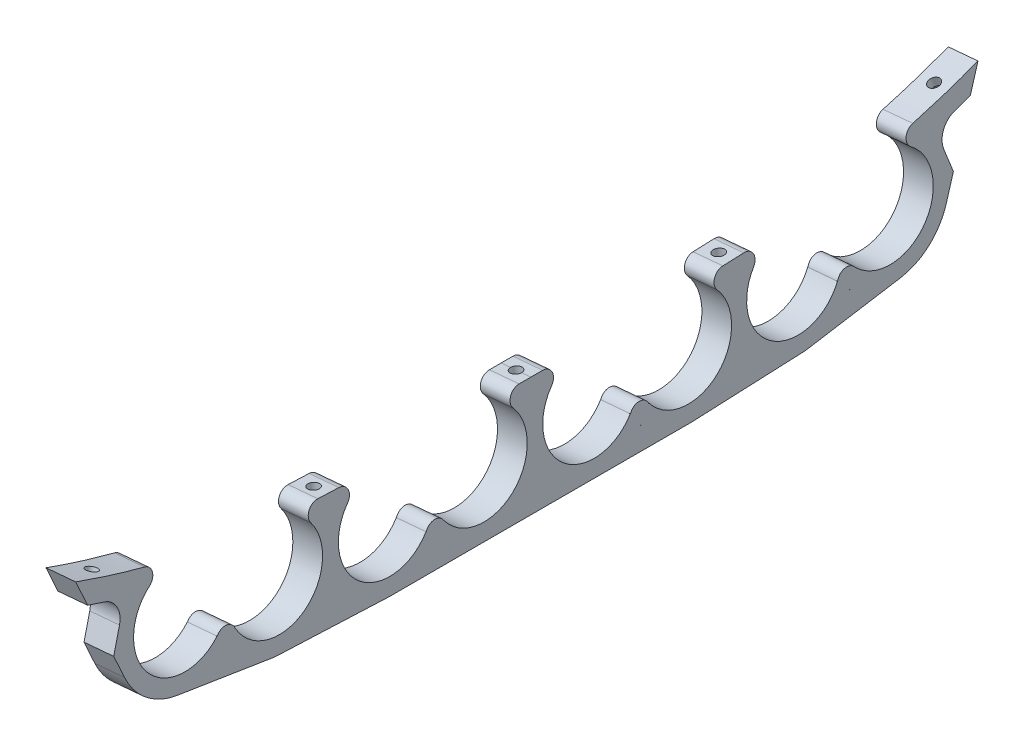
from build123d import *

# Parameters (mm, degrees)
BOSS_EXTRUDE1_START = -4.7625
BOSS_EXTRUDE1_DEPTH = 9.525
CUT_EXTRUDE1_START  = -3.556
CUT_EXTRUDE1_DEPTH  = 282.785297117
SKETCH4_R           = 1.778
CUT_EXTRUDE2_DEPTH  = 279.159394011
SKETCH5_R           = 2.921
CUT_EXTRUDE3_DEPTH  = 3.556
SKETCH6_R           = 1.778
CUT_EXTRUDE4_DEPTH  = 284.430700278
SKETCH7_R           = 2.921
CUT_EXTRUDE5_DEPTH  = 3.556
SKETCH8_R           = 1.778
CUT_EXTRUDE6_DEPTH  = 284.850761145


# Read off the part's stored shape, not the designer's step: Boss-Extrude1
with BuildPart() as part:
    # Boss-Extrude1 outline → Boss-Extrude1 (new body)
    with BuildSketch(Plane(origin=(-228.084917977, -19.938576691, -1.18e-07), x_dir=(5.118716060562233e-10, 4.474645392628448e-11, -1.0), z_dir=(0.9962008647199356, 0.08708522912212313, 5.138236917713649e-10)).offset(BOSS_EXTRUDE1_START)):
        with BuildLine():
            ThreePointArc((106.112573768, -24.014427618), (84.801506662, -29.633576123), (80.738401812, -7.971914366))
            ThreePointArc((80.738401812, -7.971914366), (80.982737482, -4.58538013), (78.026995026, -2.914481993))
            add(Edge.make_bspline(
                [(78.026995026, -2.914481993), (75.796061269, -3.025300864), (73.563882383, -3.110901905), (71.331157388, -3.172465654)],
                knots=[0.552662358, 0.552662358, 0.552662358, 0.552662358, 0.596719642, 0.596719642, 0.596719642, 0.596719642], degree=3))
            ThreePointArc((71.331157388, -3.172465654), (68.510117917, -5.073093143), (69.027544957, -8.435074375))
            ThreePointArc((69.027544957, -8.435074375), (67.134657912, -30.055875938), (45.606560008, -27.302136252))
            ThreePointArc((45.606560008, -27.302136252), (45.586817054, -27.341597019), (45.566987649, -27.381014415))
            ThreePointArc((45.566987649, -27.381014415), (42.639171658, -25.428949264), (39.708639952, -27.376935084))
            ThreePointArc((39.708639952, -27.376935084), (39.688865461, -27.33749011), (39.669177481, -27.298001886))
            ThreePointArc((39.669177481, -27.298001886), (18.196438142, -30.069314866), (16.175020916, -8.513049355))
            ThreePointArc((16.175020916, -8.513049355), (16.651150495, -5.120150934), (13.767438297, -3.270106872))
            add(Edge.make_bspline(
                [(13.767438297, -3.270106872), (12.51333277, -3.269468628), (11.25922718, -3.268778573), (10.005121591, -3.268088519)],
                knots=[0.975259294, 0.975259294, 0.975259294, 0.975259294, 1, 1, 1, 1], degree=3))
            Line((10.005121591, -3.268088519), (10.005121591, -38.444598674))
            Line((10.005121591, -38.444598674), (27.594621594, -38.444598674))
            Line((27.594621594, -38.444598674), (57.679597566, -38.465552566))
            ThreePointArc((57.679597566, -38.465552566), (58.093778372, -38.461579525), (58.507789747, -38.449085278))
            Line((58.507789747, -38.449085278), (93.658000789, -37.026204544))
            ThreePointArc((93.658000789, -37.026204544), (94.733052, -36.953825224), (95.80269018, -36.824025236))
            Line((95.80269018, -36.824025236), (125.574729046, -32.399731593))
            ThreePointArc((125.574729046, -32.399731593), (135.055544922, -28.314530372), (141.264479515, -20.066871922))
            Line((141.264479515, -20.066871922), (144.107545161, -13.070393168))
            Line((144.107545161, -13.070393168), (141.646976088, -5.930411575))
            ThreePointArc((141.646976088, -5.930411575), (142.003055106, -0.958206128), (145.839483669, 2.224785413))
            Line((145.839483669, 2.224785413), (150.966045758, 3.807639079))
            Line((150.966045758, 3.807639079), (154.106134877, 11.535060722))
            add(Edge.make_bspline(
                [(154.106134877, 11.535060722), (153.111959514, 11.196489288), (149.114455149, 9.853147022), (142.057237609, 7.670990331), (135.887203939, 6.015459011), (132.763739248, 5.234060117), (132.713280406, 5.221451519)],
                knots=[0.041773262, 0.041773262, 0.041773262, 0.041773262, 0.06250073, 0.125002606, 0.187506636, 0.188532883, 0.188532883, 0.188532883, 0.188532883], degree=3))
            ThreePointArc((132.713280406, 5.221451519), (130.369392848, 2.762612386), (131.589754054, -0.407626925))
            ThreePointArc((131.589754054, -0.407626925), (134.013026992, -22.317012563), (111.985468102, -23.141682248))
            ThreePointArc((111.985468102, -23.141682248), (111.971768934, -23.183626671), (111.957977855, -23.225540964))
            ThreePointArc((111.957977855, -23.225540964), (108.773982005, -21.727257864), (106.163261324, -24.086668669))
            ThreePointArc((106.163261324, -24.086668669), (106.137877957, -24.050575921), (106.112573768, -24.014427618))
        make_face()
        with BuildLine():
            ThreePointArc((42.710021485, -31.778107775), (42.634749976, -31.778947725), (42.55947971, -31.778002948))
            ThreePointArc((42.55947971, -31.778002948), (42.597203571, -31.735951998), (42.63480927, -31.693795344))
            ThreePointArc((42.63480927, -31.693795344), (42.672356223, -31.736004329), (42.710021485, -31.778107775))
        make_face(mode=Mode.SUBTRACT)
        with BuildLine():
            ThreePointArc((109.781702852, -27.996335289), (109.70737787, -28.008282634), (109.632790528, -28.018464504))
            ThreePointArc((109.632790528, -28.018464504), (109.66389187, -27.971301821), (109.694860726, -27.924052037))
            ThreePointArc((109.694860726, -27.924052037), (109.738231072, -27.960254595), (109.781702852, -27.996335289))
        make_face(mode=Mode.SUBTRACT)
    boss_extrude1 = extrude(amount=BOSS_EXTRUDE1_DEPTH)

    # Sketch3 → Cut-Extrude1 (cut)
    with BuildSketch(Plane(origin=(3.403167434, -38.930119016, -12.065723308), x_dir=(0.996532090421514, 0.0794795110303222, 0.02463331253624527), z_dir=(0.08320933096791158, -0.9518629984330792, -0.2950136258782986)).offset(CUT_EXTRUDE1_START)):
        with BuildLine():
            ThreePointArc((-229.611572015, -134.129981507), (-232.4089705, -131.73892561), (-235.325895799, -133.982613064))
            Line((-235.325895799, -133.982613064), (-229.611572015, -134.129981507))
        make_face()
        with BuildLine():
            Line((-229.611572015, -134.129981507), (-235.325895799, -133.982613064))
            ThreePointArc((-235.325895799, -133.982613064), (-232.824768048, -137.560041802), (-229.563276024, -134.658954733))
            ThreePointArc((-229.563276024, -134.658954733), (-229.57537508, -134.393368035), (-229.611572015, -134.129981507))
        make_face()
    cut_extrude1 = extrude(amount=CUT_EXTRUDE1_DEPTH, mode=Mode.SUBTRACT)

    # Sketch4 → Cut-Extrude2 (cut, through all)
    with BuildSketch(Plane(origin=(3.107275053, -35.545294193, -11.016654855), x_dir=(0.996532090421514, 0.07947951103032218, 0.02463331253624531), z_dir=(0.08320933096791154, -0.9518629984330789, -0.295013625878299))):
        with Locations(Location((-232.484276024, -134.658954733, 0), (0, 0, 270))):
            Circle(SKETCH4_R)
    cut_extrude2 = extrude(amount=-CUT_EXTRUDE2_DEPTH, mode=Mode.SUBTRACT)

    # Sketch5 → Cut-Extrude3 (cut)
    with BuildSketch(Plane(origin=(3.548784531, -40.595888117, -1.649588782), x_dir=(0.9962070917456914, 0.08694221859552977, 0.0035328432287039706), z_dir=(0.08701396643982783, -0.9953856637125653, -0.04044688022461796))):
        with Locations(Location((-229.154517137, -73.701115624, 0), (0, 0, 359.797416796))):
            Circle(SKETCH5_R)
    cut_extrude3 = extrude(amount=-CUT_EXTRUDE3_DEPTH, mode=Mode.SUBTRACT)

    # Sketch6 → Cut-Extrude4 (cut, through all)
    with BuildSketch(Plane(origin=(3.239362867, -37.056296697, -1.505759676), x_dir=(-0.9962070917456914, -0.0869422185955298, -0.0035328432287039723), z_dir=(0.08701396643982785, -0.9953856637125653, -0.04044688022461797))):
        with Locations(Location((229.154517137, 73.701115624, 0), (0, 0, 179.797416796))):
            Circle(SKETCH6_R)
    cut_extrude4 = extrude(amount=-CUT_EXTRUDE4_DEPTH, mode=Mode.SUBTRACT)

    # Mirror1: Boss-Extrude1, Cut-Extrude1, Cut-Extrude2, Cut-Extrude3, Cut-Extrude4 across plane
    add(boss_extrude1.mirror(Plane(origin=(-232.82932459, -20.353320095, -10.005121711), x_dir=(1.0, 0, 5.118714600400639e-10), z_dir=(-5.118714600400639e-10, -4.4748124260341065e-11, 1.0))))
    add(cut_extrude1.mirror(Plane(origin=(-232.82932459, -20.353320095, -10.005121711), x_dir=(1.0, 0, 5.118714600400639e-10), z_dir=(-5.118714600400639e-10, -4.4748124260341065e-11, 1.0))), mode=Mode.SUBTRACT)
    add(cut_extrude2.mirror(Plane(origin=(-232.82932459, -20.353320095, -10.005121711), x_dir=(1.0, 0, 5.118714600400639e-10), z_dir=(-5.118714600400639e-10, -4.4748124260341065e-11, 1.0))), mode=Mode.SUBTRACT)
    add(cut_extrude3.mirror(Plane(origin=(-232.82932459, -20.353320095, -10.005121711), x_dir=(1.0, 0, 5.118714600400639e-10), z_dir=(-5.118714600400639e-10, -4.4748124260341065e-11, 1.0))), mode=Mode.SUBTRACT)
    add(cut_extrude4.mirror(Plane(origin=(-232.82932459, -20.353320095, -10.005121711), x_dir=(1.0, 0, 5.118714600400639e-10), z_dir=(-5.118714600400639e-10, -4.4748124260341065e-11, 1.0))), mode=Mode.SUBTRACT)

    # Sketch7 → Cut-Extrude5 (cut)
    with BuildSketch(Plane(origin=(3.347956684, -38.298542443, 0), x_dir=(0.9962008647199356, 0.08708522912212316, 0), z_dir=(0.08708522912212315, -0.9962008647199355, 0))):
        with Locations((-228.954748041, -10.005121711)):
            Circle(SKETCH7_R)
    extrude(amount=-CUT_EXTRUDE5_DEPTH, mode=Mode.SUBTRACT)

    # Sketch8 → Cut-Extrude6 (cut, through all)
    with BuildSketch(Plane(origin=(3.038281609, -34.756052168, 0), x_dir=(-0.9962008647199356, -0.08708522912212319, 0), z_dir=(0.08708522912212317, -0.9962008647199355, 0))):
        with Locations(Location((228.954748041, 10.005121711, 0), (0, 0, 180))):
            Circle(SKETCH8_R)
    extrude(amount=-CUT_EXTRUDE6_DEPTH, mode=Mode.SUBTRACT)


solid = part.part
